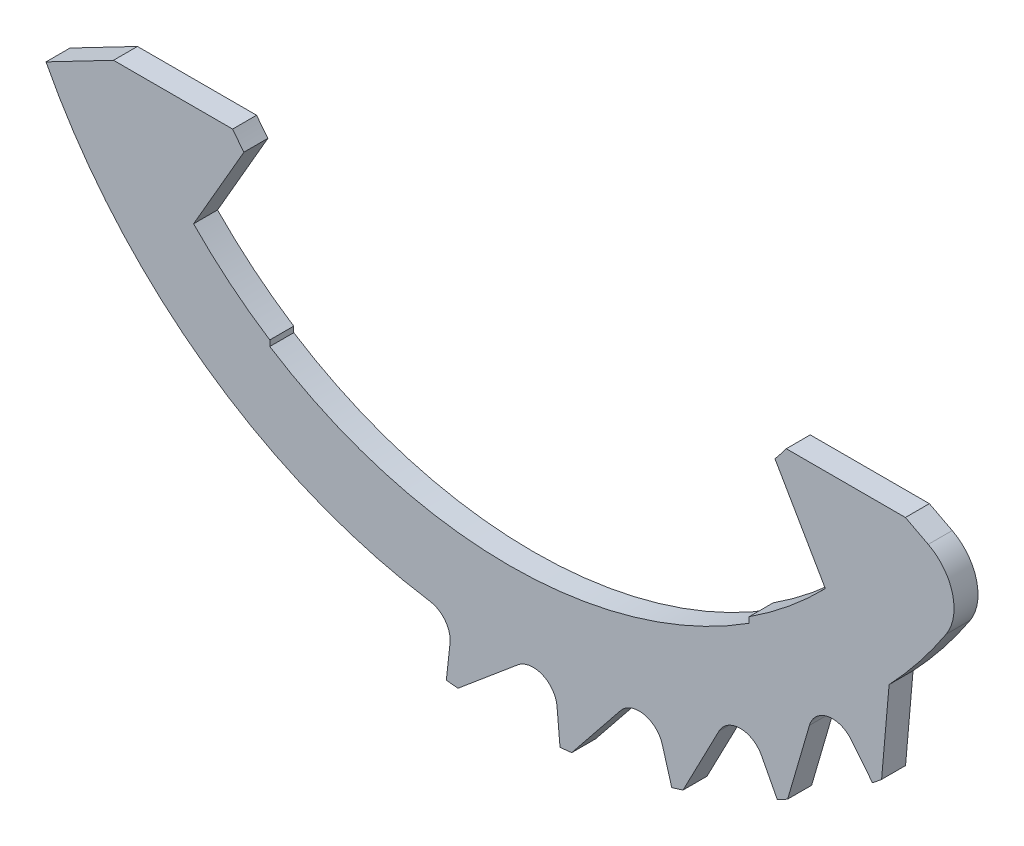
from build123d import *

# Parameters (mm, degrees)
OTHER_10076_5_DEPTH = 0.5
CUT_EXTRUDE1_START  = -0.5
CUT_EXTRUDE1_DEPTH  = 0.5


# Read off the part's stored shape, not the designer's step: 10076-5
with BuildPart() as part:
    # Other 10076-5 outline → Other 10076-5 (new body)
    with BuildSketch(Plane.XY):
        with BuildLine():
            ThreePointArc((7.573674013, -9.436602245), (7.668819519, -9.359444812), (7.763179028, -9.281328104))
            Line((7.763179028, -9.281328104), (7.919995926, -7.488902759))
            ThreePointArc((7.919995926, -7.488902759), (8.548470738, -6.76266575), (9.110578105, -5.983925684))
            ThreePointArc((9.110578105, -5.983925684), (9.242448569, -5.182849851), (8.736493865, -4.547930843))
            Line((8.736493865, -4.547930843), (8.260223146, -4.3))
            Line((8.260223146, -4.3), (5.774945887, -4.3))
            ThreePointArc((5.774945887, -4.3), (5.659072475, -4.451392897), (5.53923133, -4.5996648))
            Line((5.53923133, -4.5996648), (6.59, -6.419649523))
            ThreePointArc((6.59, -6.419649523), (5.831509763, -7.1157216), (5, -7.722693831))
            Line((5, -7.722693831), (5, -7.841555968))
            ThreePointArc((5, -7.841555968), (0, -9.3), (-5, -7.841555968))
            Line((-5, -7.841555968), (-5, -7.722693831))
            ThreePointArc((-5, -7.722693831), (-5.831509763, -7.1157216), (-6.59, -6.419649523))
            Line((-6.59, -6.419649523), (-5.53923133, -4.5996648))
            ThreePointArc((-5.53923133, -4.5996648), (-5.659072475, -4.451392897), (-5.774945887, -4.3))
            Line((-5.774945887, -4.3), (-8.260223146, -4.3))
            Line((-8.260223146, -4.3), (-10.732831081, -5.58715822))
            ThreePointArc((-10.732831081, -5.58715822), (-10.675718173, -5.6955282), (-10.617511084, -5.803314431))
            Line((-10.617511084, -5.803314431), (-9.055174855, -6.258693914))
            ThreePointArc((-9.055174855, -6.258693914), (-8.704696722, -6.64117368), (-8.882127626, -7.128661083))
            Line((-8.882127626, -7.128661083), (-9.436602245, -7.573674013))
            ThreePointArc((-9.436602245, -7.573674013), (-9.359444812, -7.668819519), (-9.281328104, -7.763179028))
            Line((-9.281328104, -7.763179028), (-7.660171598, -7.905011844))
            ThreePointArc((-7.660171598, -7.905011844), (-7.241809703, -8.211767477), (-7.320727248, -8.724502998))
            Line((-7.320727248, -8.724502998), (-7.777730077, -9.269137762))
            ThreePointArc((-7.777730077, -9.269137762), (-7.683493234, -9.347402405), (-7.588468891, -9.424709008))
            Line((-7.588468891, -9.424709008), (-5.970792243, -9.247544602))
            ThreePointArc((-5.970792243, -9.247544602), (-5.500623999, -9.466787654), (-5.477995427, -9.985067155))
            Line((-5.477995427, -9.985067155), (-5.819964104, -10.608393744))
            ThreePointArc((-5.819964104, -10.608393744), (-5.712269322, -10.666769858), (-5.603989074, -10.724052707))
            Line((-5.603989074, -10.724052707), (-4.05195869, -10.234699407))
            ThreePointArc((-4.05195869, -10.234699407), (-3.548052399, -10.358004491), (-3.424747314, -10.861910782))
            Line((-3.424747314, -10.861910782), (-3.638540174, -11.539975104))
            ThreePointArc((-3.638540174, -11.539975104), (-3.521526102, -11.576219327), (-3.404151099, -11.611277074))
            Line((-3.404151099, -11.611277074), (-1.977410637, -10.828540453))
            ThreePointArc((-1.977410637, -10.828540453), (-1.459131136, -10.851169025), (-1.239888083, -11.321337268))
            Line((-1.239888083, -11.321337268), (-1.317289186, -12.028081692))
            ThreePointArc((-1.317289186, -12.028081692), (-1.195452609, -12.04080118), (-1.073493507, -12.052286575))
            Line((-1.073493507, -12.052286575), (0.173128198, -11.006246762))
            ThreePointArc((0.173128198, -11.006246762), (0.685863719, -10.927329218), (0.992619352, -11.345691113))
            Line((0.992619352, -11.345691113), (1.054584487, -12.053955847))
            ThreePointArc((1.054584487, -12.053955847), (1.176561457, -12.042661796), (1.298417839, -12.030133462))
            Line((1.298417839, -12.030133462), (2.317013814, -10.760989181))
            ThreePointArc((2.317013814, -10.760989181), (2.804501216, -10.583558277), (3.186980982, -10.93403641))
            Line((3.186980982, -10.93403641), (3.38593107, -11.616603238))
            ThreePointArc((3.38593107, -11.616603238), (3.503360927, -11.581729673), (3.620431715, -11.545669067))
            Line((3.620431715, -11.545669067), (4.371857887, -10.10219282))
            ThreePointArc((4.371857887, -10.10219282), (4.815363304, -9.833067127), (5.258868721, -10.10219282))
            Line((5.258868721, -10.10219282), (5.58715822, -10.732831081))
            ThreePointArc((5.58715822, -10.732831081), (5.6955282, -10.675718173), (5.803314431, -10.617511084))
            Line((5.803314431, -10.617511084), (6.258693914, -9.055174855))
            ThreePointArc((6.258693914, -9.055174855), (6.64117368, -8.704696722), (7.128661083, -8.882127626))
            Line((7.128661083, -8.882127626), (7.573674013, -9.436602245))
        make_face()
    extrude(amount=OTHER_10076_5_DEPTH)

    # Sketch1 → Cut-Extrude1 (cut)
    with BuildSketch(Plane.XY.offset(0.5).offset(CUT_EXTRUDE1_START)):
        with BuildLine():
            Line((-9.668418082, -5.033059884), (-10.732831081, -5.58715822))
            ThreePointArc((-10.732831081, -5.58715822), (-7.683493234, -9.347402405), (-3.404151099, -11.611277074))
            Line((-3.404151099, -11.611277074), (-1.977410637, -10.828540453))
            ThreePointArc((-1.977410637, -10.828540453), (-1.823681131, -10.774489518), (-1.660735715, -10.772741382))
            ThreePointArc((-1.660735715, -10.772741382), (-6.350072233, -8.859265356), (-9.668418082, -5.033059884))
        make_face()
    extrude(amount=CUT_EXTRUDE1_DEPTH, mode=Mode.SUBTRACT)


solid = part.part
